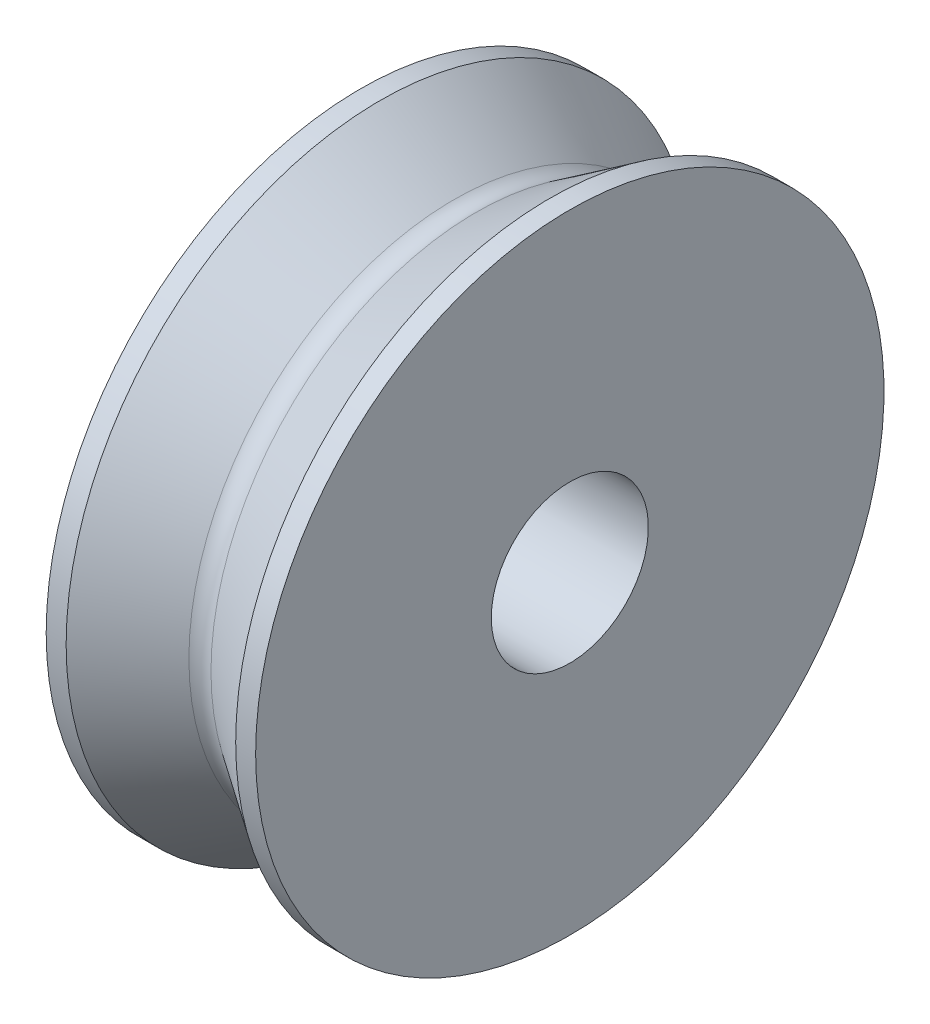
from build123d import *


with BuildPart() as part:
    # Sketch1 → Revolve1 (revolve)
    with BuildSketch(Plane.XY):
        with BuildLine():
            Line((0, 0), (4, 0))
            Line((4, 0), (4, 4.5))
            Line((4, 4.5), (3.619, 4.5))
            Line((3.619, 4.5), (2.210961772, 3.563736496))
            ThreePointArc((2.210961772, 3.563736496), (2, 3.5), (1.789038228, 3.563736496))
            Line((1.789038228, 3.563736496), (0.381, 4.5))
            Line((0.381, 4.5), (0, 4.5))
            Line((0, 4.5), (0, 0))
        make_face()
    revolve(axis=Axis((0, -1.5, 0), (1, 0, 0)))


solid = part.part
